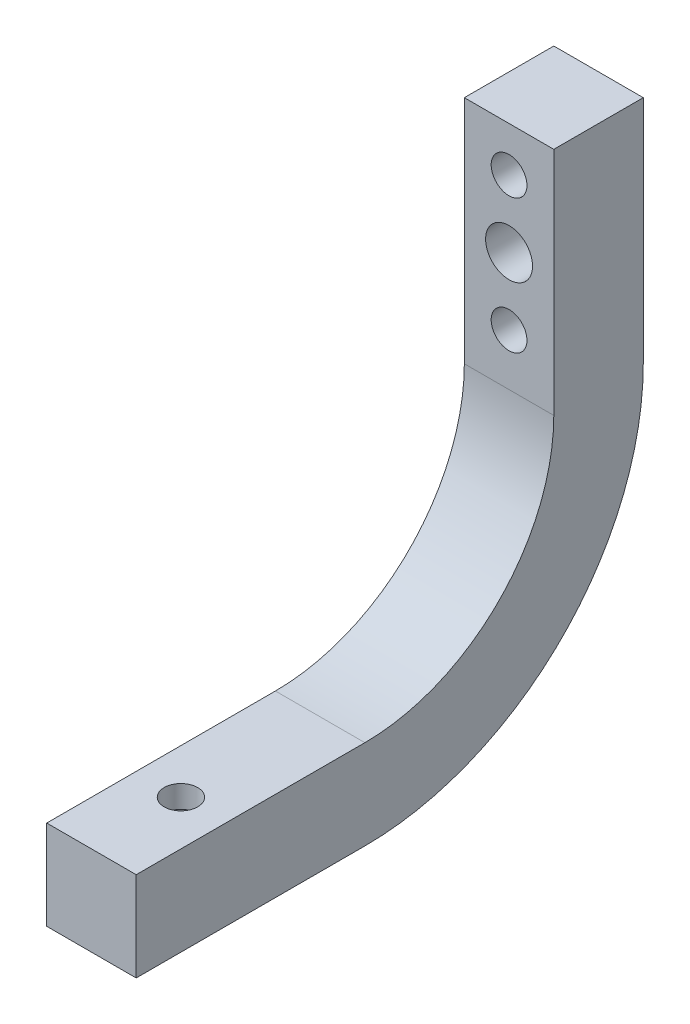
from build123d import *

# Parameters (mm, degrees)
BOSS_EXTRUDE1_DEPTH      = 4
BOSS_EXTRUDE1_DEPTH_BACK = 4
SKETCH3_R                = 1.5
CUT_EXTRUDE1_DEPTH       = 59.974279139
CUT_EXTRUDE2_DEPTH       = 52.677128403
CUT_EXTRUDE2_DEPTH_BACK  = 52.677128403
SKETCH4_R                = 2.1
SKETCH4_R_2              = 1.6
SKETCH5_R                = 2.275
CUT_EXTRUDE3_DEPTH       = 6
SKETCH6_R                = 3.825
CUT_EXTRUDE4_DEPTH       = 0.75


with BuildPart() as part:
    # Sketch1 → Boss-Extrude1 (new, two sides: drawn at the far end of the back side and taken through both)
    with BuildSketch(Plane(origin=(0, 0, 0), x_dir=(0, 0, -1), z_dir=(1, 0, 0)).offset(-BOSS_EXTRUDE1_DEPTH_BACK)):
        with BuildLine():
            Line((-8, 10), (0, 10))
            Line((0, 10), (0, -10.606666667))
            ThreePointArc((0, -10.606666667), (-7.291088527, -28.208911473), (-24.893333333, -35.5))
            Line((-24.893333333, -35.5), (-37.34, -35.5))
            Line((-37.34, -35.5), (-45.34, -35.5))
            Line((-45.34, -35.5), (-45.34, -27.5))
            Line((-45.34, -27.5), (-37.34, -27.5))
            Line((-37.34, -27.5), (-24.893333333, -27.5))
            ThreePointArc((-24.893333333, -27.5), (-12.947942776, -22.552057224), (-8, -10.606666667))
            Line((-8, -10.606666667), (-8, 10))
        make_face()
    extrude(amount=BOSS_EXTRUDE1_DEPTH + BOSS_EXTRUDE1_DEPTH_BACK)

    # Sketch3 → Cut-Extrude1 (cut, through all)
    with BuildSketch(Plane(origin=(0, -27.5, 0), x_dir=(1, 0, 0), z_dir=(0, 1, 0))):
        with Locations((0, -37.34)):
            Circle(SKETCH3_R)
    extrude(amount=-CUT_EXTRUDE1_DEPTH, mode=Mode.SUBTRACT)

    # Sketch4 → Cut-Extrude2 (cut, two sides: drawn at the far end of the back side and taken through both)
    with BuildSketch(Plane.XY.offset(8).offset(-CUT_EXTRUDE2_DEPTH_BACK)):
        Circle(SKETCH4_R)
        with Locations((0, 6)):
            Circle(SKETCH4_R_2)
        with Locations((0, -6)):
            Circle(SKETCH4_R_2)
    extrude(amount=CUT_EXTRUDE2_DEPTH + CUT_EXTRUDE2_DEPTH_BACK, mode=Mode.SUBTRACT)

    # Sketch5 → Cut-Extrude3 (cut)
    with BuildSketch(Plane.XZ.offset(35.5)):
        with Locations((0, 37.34)):
            Circle(SKETCH5_R)
    extrude(amount=-CUT_EXTRUDE3_DEPTH, mode=Mode.SUBTRACT)

    # Sketch6 → Cut-Extrude4 (cut)
    with BuildSketch(Plane.XZ.offset(35.5)):
        with Locations((0, 37.34)):
            Circle(SKETCH6_R)
    extrude(amount=-CUT_EXTRUDE4_DEPTH, mode=Mode.SUBTRACT)


solid = part.part
